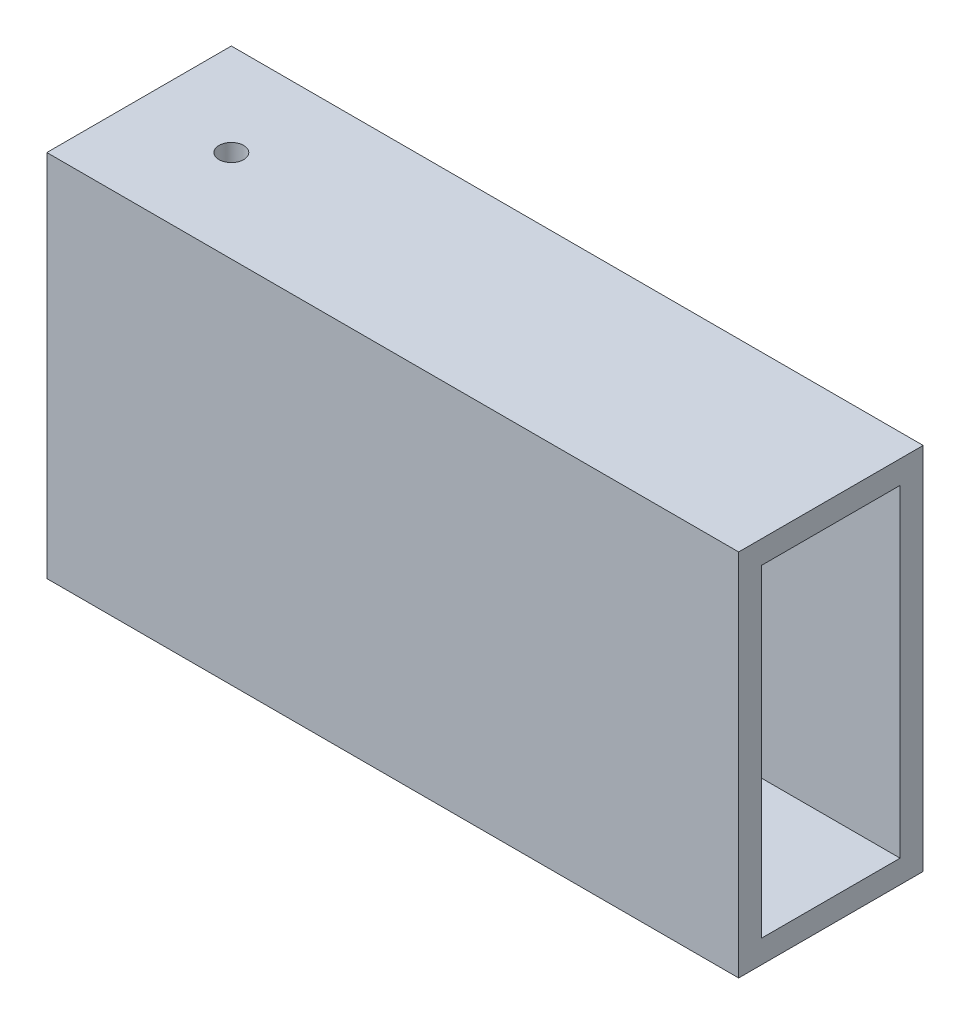
from build123d import *

# Parameters (mm, degrees)
SKETCH1_W            = 25.4
SKETCH1_H            = 50.8
SKETCH1_W_2          = 19.05
SKETCH1_H_2          = 44.45
BOSS_EXTRUDE1_DEPTH  = 95.25
CUT_EXTRUDE6_REACH   = 103.798
M3_CLEARANCE_HOLE5_D = 3.4


with BuildPart() as part:
    # Sketch1 → Boss-Extrude1 (new body)
    with BuildSketch(Plane(origin=(0, 0, 0), x_dir=(0, 0, -1), z_dir=(1, 0, 0))):
        Rectangle(SKETCH1_W, SKETCH1_H)
        Rectangle(SKETCH1_W_2, SKETCH1_H_2, mode=Mode.SUBTRACT)
    extrude(amount=BOSS_EXTRUDE1_DEPTH)

    # Sketch11 → Cut-Extrude6 (cut, up to next)
    with BuildSketch(Plane(origin=(0, 0, -12.7), x_dir=(-1, 0, 0), z_dir=(0, 0, -1)), mode=Mode.PRIVATE) as cut_extrude6_sk1:
        with BuildLine():
            Line((-25.4, 6.35), (0, 6.35))
            Line((0, 6.35), (0, -6.35))
            Line((0, -6.35), (-25.4, -6.35))
            ThreePointArc((-25.4, -6.35), (-31.75, 0), (-25.4, 6.35))
        make_face()
    cut_extrude6_tool1 = extrude(cut_extrude6_sk1.sketch, amount=-CUT_EXTRUDE6_REACH, mode=Mode.PRIVATE) & part.part
    add(cut_extrude6_tool1.solids().sort_by_distance((15.226691, 0, -12.7))[0], mode=Mode.SUBTRACT)

    # M3 Clearance Hole5 (through all)
    with Locations(Plane(origin=(12.7, -25.4, 0), x_dir=(0, 0, -1), z_dir=(0, -1, 0))):
        with Locations((0, 0)):
            Hole(M3_CLEARANCE_HOLE5_D / 2)


solid = part.part
